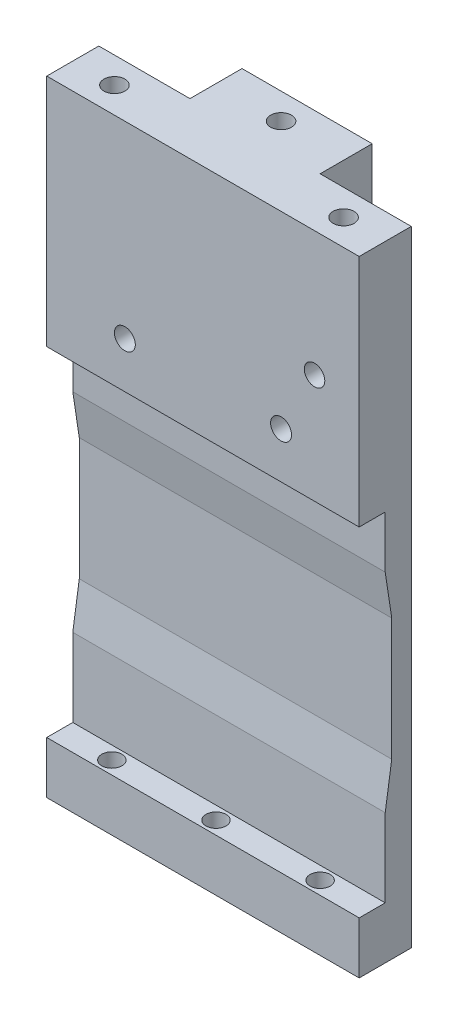
from build123d import *

# Parameters (mm, degrees)
BOSS_EXTRUDE1_DEPTH              = 76.2
CUT_EXTRUDE3_DEPTH               = 47.625
CUT_EXTRUDE4_DEPTH               = 110.433918417
F_10_0_1935_DIAMETER_HOLE1_D     = 4.9149
F_10_0_1935_DIAMETER_HOLE1_DEPTH = 19.05
F_10_0_1935_DIAMETER_HOLE1_TIP   = 1.476584928
F_1_4_20_TAPPED_HOLE1_D          = 5.1054
SKETCH19_R                       = 2.499999953
CUT_EXTRUDE5_DEPTH               = 87.135590889
F_1_4_20_TAPPED_HOLE2_D          = 5.1054
F_1_4_20_TAPPED_HOLE2_DEPTH      = 20.691183098
F_1_4_20_TAPPED_HOLE2_TIP        = 1.533816902
F_1_4_20_TAPPED_HOLE3_D          = 5.1054
F_1_4_20_TAPPED_HOLE3_DEPTH      = 9.05002
F_1_4_20_TAPPED_HOLE3_TIP        = 1.533816902
F_1_4_20_TAPPED_HOLE4_D          = 5.1054
F_1_4_20_TAPPED_HOLE4_DEPTH      = 7.356183098
F_1_4_20_TAPPED_HOLE4_TIP        = 1.533816902


with BuildPart() as part:
    # Sketch1 → Boss-Extrude1 (new, symmetric)
    with BuildSketch(Plane(origin=(0, 0, 0), x_dir=(1, 0, 0), z_dir=(0, 1, 0))):
        Polygon((-15.875, 6.35), (-15.875, 19.05), (15.875, 19.05), (15.875, 6.35), (38.1, 6.35), (38.1, -6.35), (-38.1, -6.35), (-38.1, 6.35), align=None)
    extrude(amount=BOSS_EXTRUDE1_DEPTH, both=True)

    # Sketch5 → Cut-Extrude3 (cut, symmetric)
    with BuildSketch(Plane(origin=(0, 0, 0), x_dir=(1, 0, 0), z_dir=(0, 1, 0))):
        with BuildLine():
            Line((-4.7625, 19.05), (-4.7625, 12.7))
            ThreePointArc((-4.7625, 12.7), (0, 7.9375), (4.7625, 12.7))
            Line((4.7625, 12.7), (4.7625, 19.05))
            Line((4.7625, 19.05), (-4.7625, 19.05))
        make_face()
    extrude(amount=CUT_EXTRUDE3_DEPTH, both=True, mode=Mode.SUBTRACT)

    # Sketch9 → Cut-Revolve1 (revolve, cut)
    with BuildSketch(Plane(origin=(0, 0, 0), x_dir=(0, 0, -1), z_dir=(1, 0, 0))):
        with BuildLine():
            Line((19.05, -52.3875), (12.7, -52.3875))
            ThreePointArc((12.7, -52.3875), (9.332403955, -50.992596045), (7.9375, -47.625))
            Line((7.9375, -47.625), (19.05, -47.625))
            Line((19.05, -47.625), (19.05, -52.3875))
        make_face()
    cut_revolve1 = revolve(axis=Axis((0, -47.625, -7.9375), (0, 0, -1)), mode=Mode.SUBTRACT)

    # Mirror1: Cut-Revolve1 across plane
    add(cut_revolve1.mirror(Plane.ZX), mode=Mode.SUBTRACT)

    # Sketch12 → Cut-Extrude4 (cut, through all)
    with BuildSketch(Plane(origin=(38.1, 0, 0), x_dir=(0, 0, -1), z_dir=(1, 0, 0))):
        Polygon((-6.35, -63.5), (0, -63.5), (0, -44.45), (1.5875, -33.956087115), (1.5875, -4.143912885), (0, 6.35), (0, 19.05), (-6.35, 19.05), align=None)
    extrude(amount=-CUT_EXTRUDE4_DEPTH, mode=Mode.SUBTRACT)

    # #10 (0.1935) Diameter Hole1
    with Locations(Plane(origin=(0, -76.2, 0), x_dir=(-1, 0, 0), z_dir=(0, -1, 0))):
        with Locations((25.4, -3.175), (-25.4, -3.175), (0, -3.175)):
            Hole(F_10_0_1935_DIAMETER_HOLE1_D / 2, depth=F_10_0_1935_DIAMETER_HOLE1_DEPTH)
            with Locations((0, 0, -(F_10_0_1935_DIAMETER_HOLE1_DEPTH + F_10_0_1935_DIAMETER_HOLE1_TIP / 2))):  # 118° drill point
                Cone(0, F_10_0_1935_DIAMETER_HOLE1_D / 2, F_10_0_1935_DIAMETER_HOLE1_TIP, mode=Mode.SUBTRACT)

    # 1/4-20 Tapped Hole1 (through all)
    with Locations(Plane(origin=(0, 76.2, 0), x_dir=(1, 0, 0), z_dir=(0, 1, 0))):
        with Locations((0, 12.7)):
            Hole(F_1_4_20_TAPPED_HOLE1_D / 2)

    # Sketch19 → Cut-Extrude5 (cut, through all)
    with BuildSketch(Plane(origin=(0, 0, -6.35), x_dir=(-1, 0, 0), z_dir=(0, 0, -1))):
        with Locations((-27.209019229, 45.72)):
            Circle(SKETCH19_R)
    extrude(amount=-CUT_EXTRUDE5_DEPTH, mode=Mode.SUBTRACT)

    # 1/4-20 Tapped Hole2
    with Locations(Plane(origin=(0, 76.2, 0), x_dir=(1, 0, 0), z_dir=(0, 1, 0))):
        with Locations((27.94, 0), (-27.94, 0)):
            Hole(F_1_4_20_TAPPED_HOLE2_D / 2, depth=F_1_4_20_TAPPED_HOLE2_DEPTH)
            with Locations((0, 0, -(F_1_4_20_TAPPED_HOLE2_DEPTH + F_1_4_20_TAPPED_HOLE2_TIP / 2))):  # 118° drill point
                Cone(0, F_1_4_20_TAPPED_HOLE2_D / 2, F_1_4_20_TAPPED_HOLE2_TIP, mode=Mode.SUBTRACT)

    # 1/4-20 Tapped Hole3
    with Locations(Plane(origin=(0, 0, -19.05), x_dir=(-1, 0, 0), z_dir=(0, 0, -1))):
        with Locations((-9.525, -66.675), (9.525, 57.15), (-9.525, 57.15), (9.525, -66.675)):
            Hole(F_1_4_20_TAPPED_HOLE3_D / 2, depth=F_1_4_20_TAPPED_HOLE3_DEPTH)
            with Locations((0, 0, -(F_1_4_20_TAPPED_HOLE3_DEPTH + F_1_4_20_TAPPED_HOLE3_TIP / 2))):  # 118° drill point
                Cone(0, F_1_4_20_TAPPED_HOLE3_D / 2, F_1_4_20_TAPPED_HOLE3_TIP, mode=Mode.SUBTRACT)

    # 1/4-20 Tapped Hole4
    with Locations(Plane.XY.offset(6.35)):
        with Locations((19.05, 30.260695081), (-19.05, 30.260695081)):
            Hole(F_1_4_20_TAPPED_HOLE4_D / 2, depth=F_1_4_20_TAPPED_HOLE4_DEPTH)
            with Locations((0, 0, -(F_1_4_20_TAPPED_HOLE4_DEPTH + F_1_4_20_TAPPED_HOLE4_TIP / 2))):  # 118° drill point
                Cone(0, F_1_4_20_TAPPED_HOLE4_D / 2, F_1_4_20_TAPPED_HOLE4_TIP, mode=Mode.SUBTRACT)


solid = part.part
